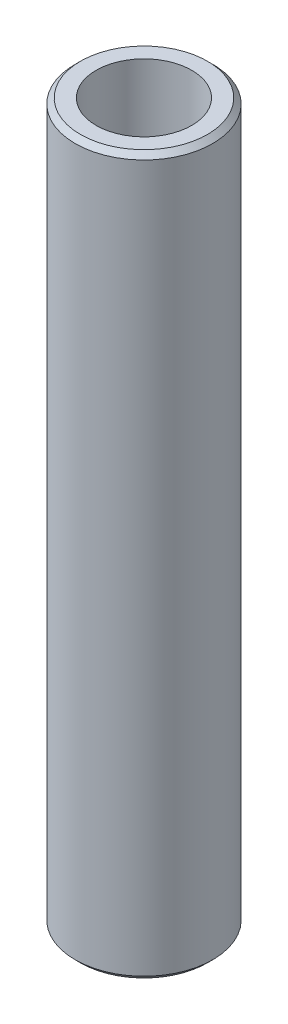
from build123d import *

# Parameters (mm, degrees)
SKETCH1_R           = 57.5
BOSS_EXTRUDE1_DEPTH = 600
SKETCH2_R           = 39.986320137
CUT_EXTRUDE1_DEPTH  = 606.485342515
CHAMFER1_SIZE       = 4.384996054


with BuildPart() as part:
    # Sketch1 → Boss-Extrude1 (new body)
    with BuildSketch(Plane(origin=(0, 0, 0), x_dir=(1, 0, 0), z_dir=(0, 1, 0))):
        Circle(SKETCH1_R)
    extrude(amount=BOSS_EXTRUDE1_DEPTH)

    # Sketch2 → Cut-Extrude1 (cut, through all)
    with BuildSketch(Plane(origin=(0, 0, 0), x_dir=(1, 0, 0), z_dir=(0, 1, 0))):
        Circle(SKETCH2_R)
    extrude(amount=CUT_EXTRUDE1_DEPTH, mode=Mode.SUBTRACT)

    # Chamfer1
    chamfer1_edges = [part.edges().sort_by_distance(p)[0] for p in [
        (-57.5, 600, 0),
        (-57.5, 0, 0),
    ]]
    chamfer(chamfer1_edges, length=CHAMFER1_SIZE)


solid = part.part
